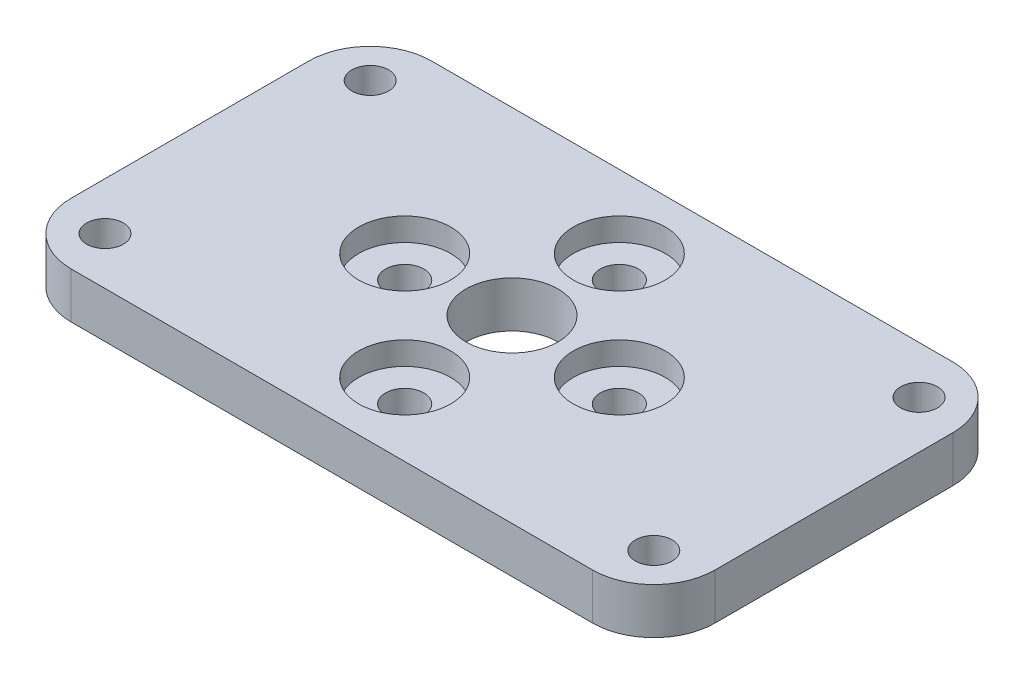
from build123d import *

# Parameters (mm, degrees)
SKETCH_1_W          = 42
SKETCH_1_H          = 23.5
SKETCH_1_R          = 1.25
SKETCH_1_R_2        = 1.2
SKETCH_1_R_3        = 3
EXTRUDE_1_DEPTH     = 3
FILLET_1_R          = 4
SKETCH_2_R          = 3
CUT_EXTRUDE_1_DEPTH = 1.5


with BuildPart() as part:
    # 草图1 → 凸台-拉伸1 (new body)
    with BuildSketch(Plane(origin=(0, 0, 0), x_dir=(1, 0, 0), z_dir=(0, 1, 0))):
        Rectangle(SKETCH_1_W, SKETCH_1_H)
        with Locations((7, 0)):
            Circle(SKETCH_1_R, mode=Mode.SUBTRACT)
        with Locations((0, -7)):
            Circle(SKETCH_1_R, mode=Mode.SUBTRACT)
        with Locations((-7, 0)):
            Circle(SKETCH_1_R, mode=Mode.SUBTRACT)
        with Locations((0, 7)):
            Circle(SKETCH_1_R, mode=Mode.SUBTRACT)
        with Locations((-17.9, 8.65)):
            Circle(SKETCH_1_R_2, mode=Mode.SUBTRACT)
        with Locations((17.9, 8.65)):
            Circle(SKETCH_1_R_2, mode=Mode.SUBTRACT)
        with Locations((-17.9, -8.65)):
            Circle(SKETCH_1_R_2, mode=Mode.SUBTRACT)
        with Locations((17.9, -8.65)):
            Circle(SKETCH_1_R_2, mode=Mode.SUBTRACT)
        Circle(SKETCH_1_R_3, mode=Mode.SUBTRACT)
    extrude(amount=EXTRUDE_1_DEPTH)

    # 圆角1
    fillet_1_edges = [part.edges().sort_by_distance(p)[0] for p in [
        (-21, 1.5, -11.75),
        (-21, 1.5, 11.75),
        (21, 1.5, 11.75),
        (21, 1.5, -11.75),
    ]]
    fillet(fillet_1_edges, radius=FILLET_1_R)

    # 草图2 → 切除-拉伸1 (cut)
    with BuildSketch(Plane(origin=(0, 3, 0), x_dir=(1, 0, 0), z_dir=(0, 1, 0))):
        with Locations((7, 0)):
            Circle(SKETCH_2_R)
        with Locations((0, -7)):
            Circle(SKETCH_2_R)
        with Locations((-7, 0)):
            Circle(SKETCH_2_R)
        with Locations((0, 7)):
            Circle(SKETCH_2_R)
    extrude(amount=-CUT_EXTRUDE_1_DEPTH, mode=Mode.SUBTRACT)


solid = part.part
